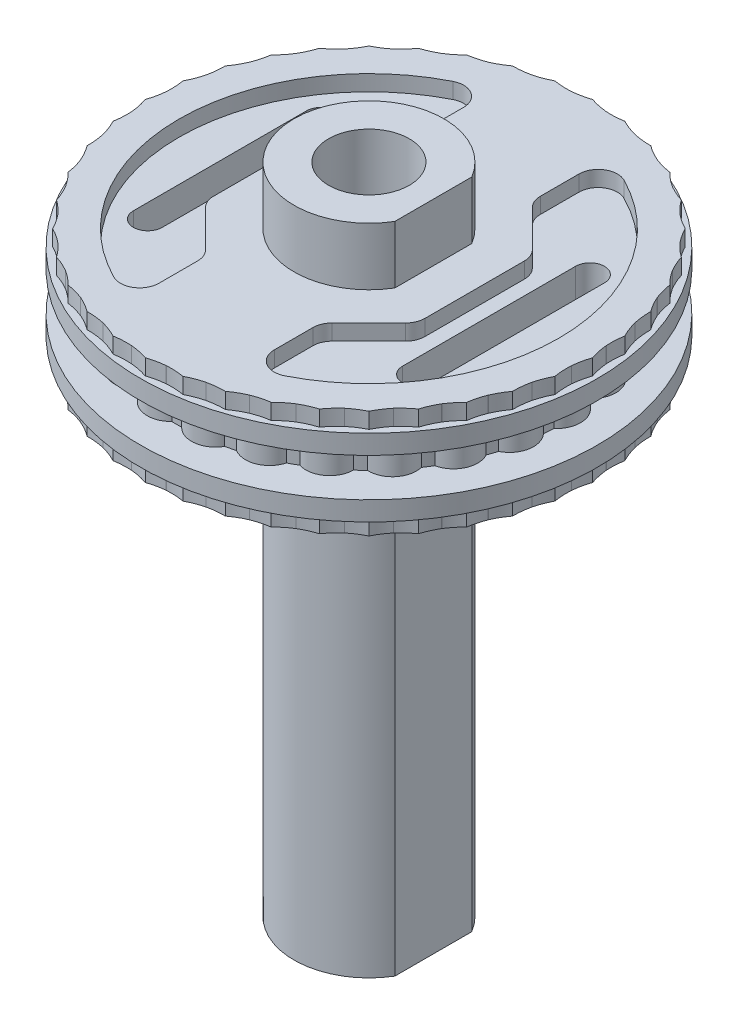
from build123d import *

# Parameters (mm, degrees)
SKETCH1_W                 = 5
SKETCH1_H                 = 1
BOSS_EXTRUDE1_START       = -1
BOSS_EXTRUDE1_DEPTH       = 1
CIRPATTERN1_COUNT         = 25
BOSS_EXTRUDE2_DEPTH       = 0.4
CIRPATTERN2_COUNT         = 40
MIRROR2_COPY_1_DEPTH      = 0.4
MIRROR2_COPY_2_DEPTH      = 0.4
MIRROR2_COPY_3_DEPTH      = 0.4
MIRROR2_COPY_4_DEPTH      = 0.4
MIRROR2_COPY_5_DEPTH      = 0.4
MIRROR2_COPY_6_DEPTH      = 0.4
MIRROR2_COPY_7_DEPTH      = 0.4
MIRROR2_COPY_8_DEPTH      = 0.4
MIRROR2_COPY_9_DEPTH      = 0.4
MIRROR2_COPY_10_DEPTH     = 0.4
MIRROR2_COPY_11_DEPTH     = 0.4
MIRROR2_COPY_12_DEPTH     = 0.4
MIRROR2_COPY_13_DEPTH     = 0.4
MIRROR2_COPY_14_DEPTH     = 0.4
MIRROR2_COPY_15_DEPTH     = 0.4
MIRROR2_COPY_16_DEPTH     = 0.4
MIRROR2_COPY_17_DEPTH     = 0.4
MIRROR2_COPY_18_DEPTH     = 0.4
MIRROR2_COPY_19_DEPTH     = 0.4
MIRROR2_COPY_20_DEPTH     = 0.4
MIRROR2_COPY_21_DEPTH     = 0.4
MIRROR2_COPY_22_DEPTH     = 0.4
MIRROR2_COPY_23_DEPTH     = 0.4
MIRROR2_COPY_24_DEPTH     = 0.4
MIRROR2_COPY_25_DEPTH     = 0.4
MIRROR2_COPY_26_DEPTH     = 0.4
MIRROR2_COPY_27_DEPTH     = 0.4
MIRROR2_COPY_28_DEPTH     = 0.4
MIRROR2_COPY_29_DEPTH     = 0.4
MIRROR2_COPY_30_DEPTH     = 0.4
MIRROR2_COPY_31_DEPTH     = 0.4
MIRROR2_COPY_32_DEPTH     = 0.4
MIRROR2_COPY_33_DEPTH     = 0.4
MIRROR2_COPY_34_DEPTH     = 0.4
MIRROR2_COPY_35_DEPTH     = 0.4
MIRROR2_COPY_36_DEPTH     = 0.4
MIRROR2_COPY_37_DEPTH     = 0.4
MIRROR2_COPY_38_DEPTH     = 0.4
MIRROR2_COPY_39_DEPTH     = 0.4
BOSS_EXTRUDE4_DEPTH       = 0.01
BOSS_EXTRUDE3_START       = 1.5
BOSS_EXTRUDE3_DEPTH       = 17
CUT_EXTRUDE2_DEPTH        = 17.403157966
CUT_EXTRUDE2_DEPTH_BACK   = 17.403157966
CUT_EXTRUDE3_DEPTH        = 0.41
F_2_0MM_DOWEL_HOLE1_D     = 2.1
F_2_0MM_DOWEL_HOLE1_DEPTH = 7.36909635
F_2_0MM_DOWEL_HOLE1_TIP   = 0.63090365
F_2_0MM_DOWEL_HOLE2_D     = 2.1
F_2_0MM_DOWEL_HOLE2_DEPTH = 7.36909635
F_2_0MM_DOWEL_HOLE2_TIP   = 0.63090365


with BuildPart() as part:
    # Sketch1 → Revolve1 (revolve)
    with BuildSketch(Plane(origin=(0, 0, 0), x_dir=(0, 0, -1), z_dir=(1, 0, 0)), mode=Mode.PRIVATE) as revolve1_sk:
        with Locations((-2.5, 0)):
            Rectangle(SKETCH1_W, SKETCH1_H)
    revolve(revolve1_sk.sketch.rotate(Axis((0, -0.599020678, 0), (0, 1, 0)), 180), axis=Axis((0, -0.599020678, 0), (0, 1, 0)))

    # Sketch2 → Boss-Extrude1 (add)
    with BuildSketch(Plane(origin=(0, 0.5, 0), x_dir=(1, 0, 0), z_dir=(0, 1, 0)).offset(BOSS_EXTRUDE1_START)):
        with BuildLine():
            ThreePointArc((-0.5, 4.974937186), (0, 5.224937186), (0.5, 4.974937186))
            ThreePointArc((0.5, 4.974937186), (0, 5), (-0.5, 4.974937186))
        make_face()
    boss_extrude1 = extrude(amount=BOSS_EXTRUDE1_DEPTH)

    # CirPattern1: Boss-Extrude1 ×25 about axis
    cirpattern1_axis = Axis((0, 0, 0), (0, 1, 0))
    for i in range(1, CIRPATTERN1_COUNT):
        add(boss_extrude1.rotate(cirpattern1_axis, i * 360 / CIRPATTERN1_COUNT))

    # Sketch3 → Revolve2 (revolve)
    with BuildSketch(Plane(origin=(0, 0, 0), x_dir=(0, 0, -1), z_dir=(1, 0, 0)), mode=Mode.PRIVATE) as revolve2_sk:
        Polygon((0, 0.5), (-5.938665307, 0.5), (-5.938665307, 1), (-5.738665307, 1), (-5.738665307, 1.4), (0, 1.4), align=None)
    revolve2 = revolve(revolve2_sk.sketch.rotate(Axis((0, 0, 0), (0, 1, 0)), 180), axis=Axis((0, 0, 0), (0, 1, 0)))

    # Sketch4 → Boss-Extrude2 (add)
    with BuildSketch(Plane(origin=(0, 1.4, 0), x_dir=(1, 0, 0), z_dir=(0, 1, 0))):
        with BuildLine():
            Line((0, 5.816841742), (0, 5.738665307))
            ThreePointArc((0, 5.738665307), (0.224059297, 5.734289576), (0.447776903, 5.721169054))
            ThreePointArc((0.447776903, 5.721169054), (0.221141488, 5.756148785), (0, 5.816841742))
        make_face()
        with BuildLine():
            ThreePointArc((-0.447776903, 5.721169054), (-0.224059297, 5.734289576), (0, 5.738665307))
            Line((0, 5.738665307), (0, 5.816841742))
            ThreePointArc((0, 5.816841742), (-0.221141488, 5.756148785), (-0.447776903, 5.721169054))
        make_face()
    boss_extrude2 = extrude(amount=-BOSS_EXTRUDE2_DEPTH)

    # CirPattern2: Boss-Extrude2 ×40 about axis
    cirpattern2_axis = Axis((0, 0, 0), (0, 1, 0))
    for i in range(1, CIRPATTERN2_COUNT):
        add(boss_extrude2.rotate(cirpattern2_axis, i * 360 / CIRPATTERN2_COUNT))

    # Mirror2: Revolve2, Boss-Extrude2 across plane
    add(revolve2.mirror(Plane.ZX))
    add(boss_extrude2.mirror(Plane.ZX))

    # Mirror2 copy 1 sketch → Mirror2 copy 1 (add)
    with BuildSketch(Plane(origin=(0, -1.4, 0), x_dir=(0.9876883405951378, 0, -0.15643446504023087), z_dir=(0, -1, 0))):
        with BuildLine():
            Line((0, -5.816841742), (0, -5.738665307))
            ThreePointArc((0, -5.738665307), (0.224059297, -5.734289576), (0.447776903, -5.721169054))
            ThreePointArc((0.447776903, -5.721169054), (0.221141488, -5.756148785), (0, -5.816841742))
        make_face()
        with BuildLine():
            ThreePointArc((-0.447776903, -5.721169054), (-0.224059297, -5.734289576), (0, -5.738665307))
            Line((0, -5.738665307), (0, -5.816841742))
            ThreePointArc((0, -5.816841742), (-0.221141488, -5.756148785), (-0.447776903, -5.721169054))
        make_face()
    extrude(amount=-MIRROR2_COPY_1_DEPTH)

    # Mirror2 copy 2 sketch → Mirror2 copy 2 (add)
    with BuildSketch(Plane(origin=(0, -1.4, 0), x_dir=(0.9510565162951535, 0, -0.3090169943749474), z_dir=(0, -1, 0))):
        with BuildLine():
            Line((0, -5.816841742), (0, -5.738665307))
            ThreePointArc((0, -5.738665307), (0.224059297, -5.734289576), (0.447776903, -5.721169054))
            ThreePointArc((0.447776903, -5.721169054), (0.221141488, -5.756148785), (0, -5.816841742))
        make_face()
        with BuildLine():
            ThreePointArc((-0.447776903, -5.721169054), (-0.224059297, -5.734289576), (0, -5.738665307))
            Line((0, -5.738665307), (0, -5.816841742))
            ThreePointArc((0, -5.816841742), (-0.221141488, -5.756148785), (-0.447776903, -5.721169054))
        make_face()
    extrude(amount=-MIRROR2_COPY_2_DEPTH)

    # Mirror2 copy 3 sketch → Mirror2 copy 3 (add)
    with BuildSketch(Plane(origin=(0, -1.4, 0), x_dir=(0.8910065241883679, 0, -0.45399049973954675), z_dir=(0, -1, 0))):
        with BuildLine():
            Line((0, -5.816841742), (0, -5.738665307))
            ThreePointArc((0, -5.738665307), (0.224059297, -5.734289576), (0.447776903, -5.721169054))
            ThreePointArc((0.447776903, -5.721169054), (0.221141488, -5.756148785), (0, -5.816841742))
        make_face()
        with BuildLine():
            ThreePointArc((-0.447776903, -5.721169054), (-0.224059297, -5.734289576), (0, -5.738665307))
            Line((0, -5.738665307), (0, -5.816841742))
            ThreePointArc((0, -5.816841742), (-0.221141488, -5.756148785), (-0.447776903, -5.721169054))
        make_face()
    extrude(amount=-MIRROR2_COPY_3_DEPTH)

    # Mirror2 copy 4 sketch → Mirror2 copy 4 (add)
    with BuildSketch(Plane(origin=(0, -1.4, 0), x_dir=(0.8090169943749475, 0, -0.5877852522924731), z_dir=(0, -1, 0))):
        with BuildLine():
            Line((0, -5.816841742), (0, -5.738665307))
            ThreePointArc((0, -5.738665307), (0.224059297, -5.734289576), (0.447776903, -5.721169054))
            ThreePointArc((0.447776903, -5.721169054), (0.221141488, -5.756148785), (0, -5.816841742))
        make_face()
        with BuildLine():
            ThreePointArc((-0.447776903, -5.721169054), (-0.224059297, -5.734289576), (0, -5.738665307))
            Line((0, -5.738665307), (0, -5.816841742))
            ThreePointArc((0, -5.816841742), (-0.221141488, -5.756148785), (-0.447776903, -5.721169054))
        make_face()
    extrude(amount=-MIRROR2_COPY_4_DEPTH)

    # Mirror2 copy 5 sketch → Mirror2 copy 5 (add)
    with BuildSketch(Plane(origin=(0, -1.4, 0), x_dir=(0.7071067811865476, 0, -0.7071067811865475), z_dir=(0, -1, 0))):
        with BuildLine():
            Line((0, -5.816841742), (0, -5.738665307))
            ThreePointArc((0, -5.738665307), (0.224059297, -5.734289576), (0.447776903, -5.721169054))
            ThreePointArc((0.447776903, -5.721169054), (0.221141488, -5.756148785), (0, -5.816841742))
        make_face()
        with BuildLine():
            ThreePointArc((-0.447776903, -5.721169054), (-0.224059297, -5.734289576), (0, -5.738665307))
            Line((0, -5.738665307), (0, -5.816841742))
            ThreePointArc((0, -5.816841742), (-0.221141488, -5.756148785), (-0.447776903, -5.721169054))
        make_face()
    extrude(amount=-MIRROR2_COPY_5_DEPTH)

    # Mirror2 copy 6 sketch → Mirror2 copy 6 (add)
    with BuildSketch(Plane(origin=(0, -1.4, 0), x_dir=(0.5877852522924731, 0, -0.8090169943749475), z_dir=(0, -1, 0))):
        with BuildLine():
            Line((0, -5.816841742), (0, -5.738665307))
            ThreePointArc((0, -5.738665307), (0.224059297, -5.734289576), (0.447776903, -5.721169054))
            ThreePointArc((0.447776903, -5.721169054), (0.221141488, -5.756148785), (0, -5.816841742))
        make_face()
        with BuildLine():
            ThreePointArc((-0.447776903, -5.721169054), (-0.224059297, -5.734289576), (0, -5.738665307))
            Line((0, -5.738665307), (0, -5.816841742))
            ThreePointArc((0, -5.816841742), (-0.221141488, -5.756148785), (-0.447776903, -5.721169054))
        make_face()
    extrude(amount=-MIRROR2_COPY_6_DEPTH)

    # Mirror2 copy 7 sketch → Mirror2 copy 7 (add)
    with BuildSketch(Plane(origin=(0, -1.4, 0), x_dir=(0.4539904997395468, 0, -0.8910065241883678), z_dir=(0, -1, 0))):
        with BuildLine():
            Line((0, -5.816841742), (0, -5.738665307))
            ThreePointArc((0, -5.738665307), (0.224059297, -5.734289576), (0.447776903, -5.721169054))
            ThreePointArc((0.447776903, -5.721169054), (0.221141488, -5.756148785), (0, -5.816841742))
        make_face()
        with BuildLine():
            ThreePointArc((-0.447776903, -5.721169054), (-0.224059297, -5.734289576), (0, -5.738665307))
            Line((0, -5.738665307), (0, -5.816841742))
            ThreePointArc((0, -5.816841742), (-0.221141488, -5.756148785), (-0.447776903, -5.721169054))
        make_face()
    extrude(amount=-MIRROR2_COPY_7_DEPTH)

    # Mirror2 copy 8 sketch → Mirror2 copy 8 (add)
    with BuildSketch(Plane(origin=(0, -1.4, 0), x_dir=(0.30901699437494745, 0, -0.9510565162951535), z_dir=(0, -1, 0))):
        with BuildLine():
            Line((0, -5.816841742), (0, -5.738665307))
            ThreePointArc((0, -5.738665307), (0.224059297, -5.734289576), (0.447776903, -5.721169054))
            ThreePointArc((0.447776903, -5.721169054), (0.221141488, -5.756148785), (0, -5.816841742))
        make_face()
        with BuildLine():
            ThreePointArc((-0.447776903, -5.721169054), (-0.224059297, -5.734289576), (0, -5.738665307))
            Line((0, -5.738665307), (0, -5.816841742))
            ThreePointArc((0, -5.816841742), (-0.221141488, -5.756148785), (-0.447776903, -5.721169054))
        make_face()
    extrude(amount=-MIRROR2_COPY_8_DEPTH)

    # Mirror2 copy 9 sketch → Mirror2 copy 9 (add)
    with BuildSketch(Plane(origin=(0, -1.4, 0), x_dir=(0.15643446504023092, 0, -0.9876883405951378), z_dir=(0, -1, 0))):
        with BuildLine():
            Line((0, -5.816841742), (0, -5.738665307))
            ThreePointArc((0, -5.738665307), (0.224059297, -5.734289576), (0.447776903, -5.721169054))
            ThreePointArc((0.447776903, -5.721169054), (0.221141488, -5.756148785), (0, -5.816841742))
        make_face()
        with BuildLine():
            ThreePointArc((-0.447776903, -5.721169054), (-0.224059297, -5.734289576), (0, -5.738665307))
            Line((0, -5.738665307), (0, -5.816841742))
            ThreePointArc((0, -5.816841742), (-0.221141488, -5.756148785), (-0.447776903, -5.721169054))
        make_face()
    extrude(amount=-MIRROR2_COPY_9_DEPTH)

    # Mirror2 copy 10 sketch → Mirror2 copy 10 (add)
    with BuildSketch(Plane(origin=(0, -1.4, 0), x_dir=(0, 0, -1), z_dir=(0, -1, 0))):
        with BuildLine():
            Line((0, -5.816841742), (0, -5.738665307))
            ThreePointArc((0, -5.738665307), (0.224059297, -5.734289576), (0.447776903, -5.721169054))
            ThreePointArc((0.447776903, -5.721169054), (0.221141488, -5.756148785), (0, -5.816841742))
        make_face()
        with BuildLine():
            ThreePointArc((-0.447776903, -5.721169054), (-0.224059297, -5.734289576), (0, -5.738665307))
            Line((0, -5.738665307), (0, -5.816841742))
            ThreePointArc((0, -5.816841742), (-0.221141488, -5.756148785), (-0.447776903, -5.721169054))
        make_face()
    extrude(amount=-MIRROR2_COPY_10_DEPTH)

    # Mirror2 copy 11 sketch → Mirror2 copy 11 (add)
    with BuildSketch(Plane(origin=(0, -1.4, 0), x_dir=(-0.1564344650402308, 0, -0.9876883405951378), z_dir=(0, -1, 0))):
        with BuildLine():
            Line((0, -5.816841742), (0, -5.738665307))
            ThreePointArc((0, -5.738665307), (0.224059297, -5.734289576), (0.447776903, -5.721169054))
            ThreePointArc((0.447776903, -5.721169054), (0.221141488, -5.756148785), (0, -5.816841742))
        make_face()
        with BuildLine():
            ThreePointArc((-0.447776903, -5.721169054), (-0.224059297, -5.734289576), (0, -5.738665307))
            Line((0, -5.738665307), (0, -5.816841742))
            ThreePointArc((0, -5.816841742), (-0.221141488, -5.756148785), (-0.447776903, -5.721169054))
        make_face()
    extrude(amount=-MIRROR2_COPY_11_DEPTH)

    # Mirror2 copy 12 sketch → Mirror2 copy 12 (add)
    with BuildSketch(Plane(origin=(0, -1.4, 0), x_dir=(-0.30901699437494734, 0, -0.9510565162951536), z_dir=(0, -1, 0))):
        with BuildLine():
            Line((0, -5.816841742), (0, -5.738665307))
            ThreePointArc((0, -5.738665307), (0.224059297, -5.734289576), (0.447776903, -5.721169054))
            ThreePointArc((0.447776903, -5.721169054), (0.221141488, -5.756148785), (0, -5.816841742))
        make_face()
        with BuildLine():
            ThreePointArc((-0.447776903, -5.721169054), (-0.224059297, -5.734289576), (0, -5.738665307))
            Line((0, -5.738665307), (0, -5.816841742))
            ThreePointArc((0, -5.816841742), (-0.221141488, -5.756148785), (-0.447776903, -5.721169054))
        make_face()
    extrude(amount=-MIRROR2_COPY_12_DEPTH)

    # Mirror2 copy 13 sketch → Mirror2 copy 13 (add)
    with BuildSketch(Plane(origin=(0, -1.4, 0), x_dir=(-0.4539904997395467, 0, -0.8910065241883679), z_dir=(0, -1, 0))):
        with BuildLine():
            Line((0, -5.816841742), (0, -5.738665307))
            ThreePointArc((0, -5.738665307), (0.224059297, -5.734289576), (0.447776903, -5.721169054))
            ThreePointArc((0.447776903, -5.721169054), (0.221141488, -5.756148785), (0, -5.816841742))
        make_face()
        with BuildLine():
            ThreePointArc((-0.447776903, -5.721169054), (-0.224059297, -5.734289576), (0, -5.738665307))
            Line((0, -5.738665307), (0, -5.816841742))
            ThreePointArc((0, -5.816841742), (-0.221141488, -5.756148785), (-0.447776903, -5.721169054))
        make_face()
    extrude(amount=-MIRROR2_COPY_13_DEPTH)

    # Mirror2 copy 14 sketch → Mirror2 copy 14 (add)
    with BuildSketch(Plane(origin=(0, -1.4, 0), x_dir=(-0.587785252292473, 0, -0.8090169943749475), z_dir=(0, -1, 0))):
        with BuildLine():
            Line((0, -5.816841742), (0, -5.738665307))
            ThreePointArc((0, -5.738665307), (0.224059297, -5.734289576), (0.447776903, -5.721169054))
            ThreePointArc((0.447776903, -5.721169054), (0.221141488, -5.756148785), (0, -5.816841742))
        make_face()
        with BuildLine():
            ThreePointArc((-0.447776903, -5.721169054), (-0.224059297, -5.734289576), (0, -5.738665307))
            Line((0, -5.738665307), (0, -5.816841742))
            ThreePointArc((0, -5.816841742), (-0.221141488, -5.756148785), (-0.447776903, -5.721169054))
        make_face()
    extrude(amount=-MIRROR2_COPY_14_DEPTH)

    # Mirror2 copy 15 sketch → Mirror2 copy 15 (add)
    with BuildSketch(Plane(origin=(0, -1.4, 0), x_dir=(-0.7071067811865475, 0, -0.7071067811865476), z_dir=(0, -1, 0))):
        with BuildLine():
            Line((0, -5.816841742), (0, -5.738665307))
            ThreePointArc((0, -5.738665307), (0.224059297, -5.734289576), (0.447776903, -5.721169054))
            ThreePointArc((0.447776903, -5.721169054), (0.221141488, -5.756148785), (0, -5.816841742))
        make_face()
        with BuildLine():
            ThreePointArc((-0.447776903, -5.721169054), (-0.224059297, -5.734289576), (0, -5.738665307))
            Line((0, -5.738665307), (0, -5.816841742))
            ThreePointArc((0, -5.816841742), (-0.221141488, -5.756148785), (-0.447776903, -5.721169054))
        make_face()
    extrude(amount=-MIRROR2_COPY_15_DEPTH)

    # Mirror2 copy 16 sketch → Mirror2 copy 16 (add)
    with BuildSketch(Plane(origin=(0, -1.4, 0), x_dir=(-0.8090169943749473, 0, -0.5877852522924732), z_dir=(0, -1, 0))):
        with BuildLine():
            Line((0, -5.816841742), (0, -5.738665307))
            ThreePointArc((0, -5.738665307), (0.224059297, -5.734289576), (0.447776903, -5.721169054))
            ThreePointArc((0.447776903, -5.721169054), (0.221141488, -5.756148785), (0, -5.816841742))
        make_face()
        with BuildLine():
            ThreePointArc((-0.447776903, -5.721169054), (-0.224059297, -5.734289576), (0, -5.738665307))
            Line((0, -5.738665307), (0, -5.816841742))
            ThreePointArc((0, -5.816841742), (-0.221141488, -5.756148785), (-0.447776903, -5.721169054))
        make_face()
    extrude(amount=-MIRROR2_COPY_16_DEPTH)

    # Mirror2 copy 17 sketch → Mirror2 copy 17 (add)
    with BuildSketch(Plane(origin=(0, -1.4, 0), x_dir=(-0.8910065241883678, 0, -0.45399049973954686), z_dir=(0, -1, 0))):
        with BuildLine():
            Line((0, -5.816841742), (0, -5.738665307))
            ThreePointArc((0, -5.738665307), (0.224059297, -5.734289576), (0.447776903, -5.721169054))
            ThreePointArc((0.447776903, -5.721169054), (0.221141488, -5.756148785), (0, -5.816841742))
        make_face()
        with BuildLine():
            ThreePointArc((-0.447776903, -5.721169054), (-0.224059297, -5.734289576), (0, -5.738665307))
            Line((0, -5.738665307), (0, -5.816841742))
            ThreePointArc((0, -5.816841742), (-0.221141488, -5.756148785), (-0.447776903, -5.721169054))
        make_face()
    extrude(amount=-MIRROR2_COPY_17_DEPTH)

    # Mirror2 copy 18 sketch → Mirror2 copy 18 (add)
    with BuildSketch(Plane(origin=(0, -1.4, 0), x_dir=(-0.9510565162951535, 0, -0.3090169943749475), z_dir=(0, -1, 0))):
        with BuildLine():
            Line((0, -5.816841742), (0, -5.738665307))
            ThreePointArc((0, -5.738665307), (0.224059297, -5.734289576), (0.447776903, -5.721169054))
            ThreePointArc((0.447776903, -5.721169054), (0.221141488, -5.756148785), (0, -5.816841742))
        make_face()
        with BuildLine():
            ThreePointArc((-0.447776903, -5.721169054), (-0.224059297, -5.734289576), (0, -5.738665307))
            Line((0, -5.738665307), (0, -5.816841742))
            ThreePointArc((0, -5.816841742), (-0.221141488, -5.756148785), (-0.447776903, -5.721169054))
        make_face()
    extrude(amount=-MIRROR2_COPY_18_DEPTH)

    # Mirror2 copy 19 sketch → Mirror2 copy 19 (add)
    with BuildSketch(Plane(origin=(0, -1.4, 0), x_dir=(-0.9876883405951377, 0, -0.15643446504023098), z_dir=(0, -1, 0))):
        with BuildLine():
            Line((0, -5.816841742), (0, -5.738665307))
            ThreePointArc((0, -5.738665307), (0.224059297, -5.734289576), (0.447776903, -5.721169054))
            ThreePointArc((0.447776903, -5.721169054), (0.221141488, -5.756148785), (0, -5.816841742))
        make_face()
        with BuildLine():
            ThreePointArc((-0.447776903, -5.721169054), (-0.224059297, -5.734289576), (0, -5.738665307))
            Line((0, -5.738665307), (0, -5.816841742))
            ThreePointArc((0, -5.816841742), (-0.221141488, -5.756148785), (-0.447776903, -5.721169054))
        make_face()
    extrude(amount=-MIRROR2_COPY_19_DEPTH)

    # Mirror2 copy 20 sketch → Mirror2 copy 20 (add)
    with BuildSketch(Plane(origin=(0, -1.4, 0), x_dir=(-1, 0, 0), z_dir=(0, -1, 0))):
        with BuildLine():
            Line((0, -5.816841742), (0, -5.738665307))
            ThreePointArc((0, -5.738665307), (0.224059297, -5.734289576), (0.447776903, -5.721169054))
            ThreePointArc((0.447776903, -5.721169054), (0.221141488, -5.756148785), (0, -5.816841742))
        make_face()
        with BuildLine():
            ThreePointArc((-0.447776903, -5.721169054), (-0.224059297, -5.734289576), (0, -5.738665307))
            Line((0, -5.738665307), (0, -5.816841742))
            ThreePointArc((0, -5.816841742), (-0.221141488, -5.756148785), (-0.447776903, -5.721169054))
        make_face()
    extrude(amount=-MIRROR2_COPY_20_DEPTH)

    # Mirror2 copy 21 sketch → Mirror2 copy 21 (add)
    with BuildSketch(Plane(origin=(0, -1.4, 0), x_dir=(-0.9876883405951378, 0, 0.15643446504023073), z_dir=(0, -1, 0))):
        with BuildLine():
            Line((0, -5.816841742), (0, -5.738665307))
            ThreePointArc((0, -5.738665307), (0.224059297, -5.734289576), (0.447776903, -5.721169054))
            ThreePointArc((0.447776903, -5.721169054), (0.221141488, -5.756148785), (0, -5.816841742))
        make_face()
        with BuildLine():
            ThreePointArc((-0.447776903, -5.721169054), (-0.224059297, -5.734289576), (0, -5.738665307))
            Line((0, -5.738665307), (0, -5.816841742))
            ThreePointArc((0, -5.816841742), (-0.221141488, -5.756148785), (-0.447776903, -5.721169054))
        make_face()
    extrude(amount=-MIRROR2_COPY_21_DEPTH)

    # Mirror2 copy 22 sketch → Mirror2 copy 22 (add)
    with BuildSketch(Plane(origin=(0, -1.4, 0), x_dir=(-0.9510565162951536, 0, 0.3090169943749473), z_dir=(0, -1, 0))):
        with BuildLine():
            Line((0, -5.816841742), (0, -5.738665307))
            ThreePointArc((0, -5.738665307), (0.224059297, -5.734289576), (0.447776903, -5.721169054))
            ThreePointArc((0.447776903, -5.721169054), (0.221141488, -5.756148785), (0, -5.816841742))
        make_face()
        with BuildLine():
            ThreePointArc((-0.447776903, -5.721169054), (-0.224059297, -5.734289576), (0, -5.738665307))
            Line((0, -5.738665307), (0, -5.816841742))
            ThreePointArc((0, -5.816841742), (-0.221141488, -5.756148785), (-0.447776903, -5.721169054))
        make_face()
    extrude(amount=-MIRROR2_COPY_22_DEPTH)

    # Mirror2 copy 23 sketch → Mirror2 copy 23 (add)
    with BuildSketch(Plane(origin=(0, -1.4, 0), x_dir=(-0.8910065241883679, 0, 0.4539904997395467), z_dir=(0, -1, 0))):
        with BuildLine():
            Line((0, -5.816841742), (0, -5.738665307))
            ThreePointArc((0, -5.738665307), (0.224059297, -5.734289576), (0.447776903, -5.721169054))
            ThreePointArc((0.447776903, -5.721169054), (0.221141488, -5.756148785), (0, -5.816841742))
        make_face()
        with BuildLine():
            ThreePointArc((-0.447776903, -5.721169054), (-0.224059297, -5.734289576), (0, -5.738665307))
            Line((0, -5.738665307), (0, -5.816841742))
            ThreePointArc((0, -5.816841742), (-0.221141488, -5.756148785), (-0.447776903, -5.721169054))
        make_face()
    extrude(amount=-MIRROR2_COPY_23_DEPTH)

    # Mirror2 copy 24 sketch → Mirror2 copy 24 (add)
    with BuildSketch(Plane(origin=(0, -1.4, 0), x_dir=(-0.8090169943749476, 0, 0.587785252292473), z_dir=(0, -1, 0))):
        with BuildLine():
            Line((0, -5.816841742), (0, -5.738665307))
            ThreePointArc((0, -5.738665307), (0.224059297, -5.734289576), (0.447776903, -5.721169054))
            ThreePointArc((0.447776903, -5.721169054), (0.221141488, -5.756148785), (0, -5.816841742))
        make_face()
        with BuildLine():
            ThreePointArc((-0.447776903, -5.721169054), (-0.224059297, -5.734289576), (0, -5.738665307))
            Line((0, -5.738665307), (0, -5.816841742))
            ThreePointArc((0, -5.816841742), (-0.221141488, -5.756148785), (-0.447776903, -5.721169054))
        make_face()
    extrude(amount=-MIRROR2_COPY_24_DEPTH)

    # Mirror2 copy 25 sketch → Mirror2 copy 25 (add)
    with BuildSketch(Plane(origin=(0, -1.4, 0), x_dir=(-0.7071067811865477, 0, 0.7071067811865475), z_dir=(0, -1, 0))):
        with BuildLine():
            Line((0, -5.816841742), (0, -5.738665307))
            ThreePointArc((0, -5.738665307), (0.224059297, -5.734289576), (0.447776903, -5.721169054))
            ThreePointArc((0.447776903, -5.721169054), (0.221141488, -5.756148785), (0, -5.816841742))
        make_face()
        with BuildLine():
            ThreePointArc((-0.447776903, -5.721169054), (-0.224059297, -5.734289576), (0, -5.738665307))
            Line((0, -5.738665307), (0, -5.816841742))
            ThreePointArc((0, -5.816841742), (-0.221141488, -5.756148785), (-0.447776903, -5.721169054))
        make_face()
    extrude(amount=-MIRROR2_COPY_25_DEPTH)

    # Mirror2 copy 26 sketch → Mirror2 copy 26 (add)
    with BuildSketch(Plane(origin=(0, -1.4, 0), x_dir=(-0.5877852522924732, 0, 0.8090169943749473), z_dir=(0, -1, 0))):
        with BuildLine():
            Line((0, -5.816841742), (0, -5.738665307))
            ThreePointArc((0, -5.738665307), (0.224059297, -5.734289576), (0.447776903, -5.721169054))
            ThreePointArc((0.447776903, -5.721169054), (0.221141488, -5.756148785), (0, -5.816841742))
        make_face()
        with BuildLine():
            ThreePointArc((-0.447776903, -5.721169054), (-0.224059297, -5.734289576), (0, -5.738665307))
            Line((0, -5.738665307), (0, -5.816841742))
            ThreePointArc((0, -5.816841742), (-0.221141488, -5.756148785), (-0.447776903, -5.721169054))
        make_face()
    extrude(amount=-MIRROR2_COPY_26_DEPTH)

    # Mirror2 copy 27 sketch → Mirror2 copy 27 (add)
    with BuildSketch(Plane(origin=(0, -1.4, 0), x_dir=(-0.4539904997395469, 0, 0.8910065241883678), z_dir=(0, -1, 0))):
        with BuildLine():
            Line((0, -5.816841742), (0, -5.738665307))
            ThreePointArc((0, -5.738665307), (0.224059297, -5.734289576), (0.447776903, -5.721169054))
            ThreePointArc((0.447776903, -5.721169054), (0.221141488, -5.756148785), (0, -5.816841742))
        make_face()
        with BuildLine():
            ThreePointArc((-0.447776903, -5.721169054), (-0.224059297, -5.734289576), (0, -5.738665307))
            Line((0, -5.738665307), (0, -5.816841742))
            ThreePointArc((0, -5.816841742), (-0.221141488, -5.756148785), (-0.447776903, -5.721169054))
        make_face()
    extrude(amount=-MIRROR2_COPY_27_DEPTH)

    # Mirror2 copy 28 sketch → Mirror2 copy 28 (add)
    with BuildSketch(Plane(origin=(0, -1.4, 0), x_dir=(-0.30901699437494756, 0, 0.9510565162951535), z_dir=(0, -1, 0))):
        with BuildLine():
            Line((0, -5.816841742), (0, -5.738665307))
            ThreePointArc((0, -5.738665307), (0.224059297, -5.734289576), (0.447776903, -5.721169054))
            ThreePointArc((0.447776903, -5.721169054), (0.221141488, -5.756148785), (0, -5.816841742))
        make_face()
        with BuildLine():
            ThreePointArc((-0.447776903, -5.721169054), (-0.224059297, -5.734289576), (0, -5.738665307))
            Line((0, -5.738665307), (0, -5.816841742))
            ThreePointArc((0, -5.816841742), (-0.221141488, -5.756148785), (-0.447776903, -5.721169054))
        make_face()
    extrude(amount=-MIRROR2_COPY_28_DEPTH)

    # Mirror2 copy 29 sketch → Mirror2 copy 29 (add)
    with BuildSketch(Plane(origin=(0, -1.4, 0), x_dir=(-0.15643446504023104, 0, 0.9876883405951377), z_dir=(0, -1, 0))):
        with BuildLine():
            Line((0, -5.816841742), (0, -5.738665307))
            ThreePointArc((0, -5.738665307), (0.224059297, -5.734289576), (0.447776903, -5.721169054))
            ThreePointArc((0.447776903, -5.721169054), (0.221141488, -5.756148785), (0, -5.816841742))
        make_face()
        with BuildLine():
            ThreePointArc((-0.447776903, -5.721169054), (-0.224059297, -5.734289576), (0, -5.738665307))
            Line((0, -5.738665307), (0, -5.816841742))
            ThreePointArc((0, -5.816841742), (-0.221141488, -5.756148785), (-0.447776903, -5.721169054))
        make_face()
    extrude(amount=-MIRROR2_COPY_29_DEPTH)

    # Mirror2 copy 30 sketch → Mirror2 copy 30 (add)
    with BuildSketch(Plane(origin=(0, -1.4, 0), x_dir=(0, 0, 1), z_dir=(0, -1, 0))):
        with BuildLine():
            Line((0, -5.816841742), (0, -5.738665307))
            ThreePointArc((0, -5.738665307), (0.224059297, -5.734289576), (0.447776903, -5.721169054))
            ThreePointArc((0.447776903, -5.721169054), (0.221141488, -5.756148785), (0, -5.816841742))
        make_face()
        with BuildLine():
            ThreePointArc((-0.447776903, -5.721169054), (-0.224059297, -5.734289576), (0, -5.738665307))
            Line((0, -5.738665307), (0, -5.816841742))
            ThreePointArc((0, -5.816841742), (-0.221141488, -5.756148785), (-0.447776903, -5.721169054))
        make_face()
    extrude(amount=-MIRROR2_COPY_30_DEPTH)

    # Mirror2 copy 31 sketch → Mirror2 copy 31 (add)
    with BuildSketch(Plane(origin=(0, -1.4, 0), x_dir=(0.15643446504023067, 0, 0.9876883405951378), z_dir=(0, -1, 0))):
        with BuildLine():
            Line((0, -5.816841742), (0, -5.738665307))
            ThreePointArc((0, -5.738665307), (0.224059297, -5.734289576), (0.447776903, -5.721169054))
            ThreePointArc((0.447776903, -5.721169054), (0.221141488, -5.756148785), (0, -5.816841742))
        make_face()
        with BuildLine():
            ThreePointArc((-0.447776903, -5.721169054), (-0.224059297, -5.734289576), (0, -5.738665307))
            Line((0, -5.738665307), (0, -5.816841742))
            ThreePointArc((0, -5.816841742), (-0.221141488, -5.756148785), (-0.447776903, -5.721169054))
        make_face()
    extrude(amount=-MIRROR2_COPY_31_DEPTH)

    # Mirror2 copy 32 sketch → Mirror2 copy 32 (add)
    with BuildSketch(Plane(origin=(0, -1.4, 0), x_dir=(0.30901699437494723, 0, 0.9510565162951536), z_dir=(0, -1, 0))):
        with BuildLine():
            Line((0, -5.816841742), (0, -5.738665307))
            ThreePointArc((0, -5.738665307), (0.224059297, -5.734289576), (0.447776903, -5.721169054))
            ThreePointArc((0.447776903, -5.721169054), (0.221141488, -5.756148785), (0, -5.816841742))
        make_face()
        with BuildLine():
            ThreePointArc((-0.447776903, -5.721169054), (-0.224059297, -5.734289576), (0, -5.738665307))
            Line((0, -5.738665307), (0, -5.816841742))
            ThreePointArc((0, -5.816841742), (-0.221141488, -5.756148785), (-0.447776903, -5.721169054))
        make_face()
    extrude(amount=-MIRROR2_COPY_32_DEPTH)

    # Mirror2 copy 33 sketch → Mirror2 copy 33 (add)
    with BuildSketch(Plane(origin=(0, -1.4, 0), x_dir=(0.45399049973954664, 0, 0.891006524188368), z_dir=(0, -1, 0))):
        with BuildLine():
            Line((0, -5.816841742), (0, -5.738665307))
            ThreePointArc((0, -5.738665307), (0.224059297, -5.734289576), (0.447776903, -5.721169054))
            ThreePointArc((0.447776903, -5.721169054), (0.221141488, -5.756148785), (0, -5.816841742))
        make_face()
        with BuildLine():
            ThreePointArc((-0.447776903, -5.721169054), (-0.224059297, -5.734289576), (0, -5.738665307))
            Line((0, -5.738665307), (0, -5.816841742))
            ThreePointArc((0, -5.816841742), (-0.221141488, -5.756148785), (-0.447776903, -5.721169054))
        make_face()
    extrude(amount=-MIRROR2_COPY_33_DEPTH)

    # Mirror2 copy 34 sketch → Mirror2 copy 34 (add)
    with BuildSketch(Plane(origin=(0, -1.4, 0), x_dir=(0.5877852522924729, 0, 0.8090169943749476), z_dir=(0, -1, 0))):
        with BuildLine():
            Line((0, -5.816841742), (0, -5.738665307))
            ThreePointArc((0, -5.738665307), (0.224059297, -5.734289576), (0.447776903, -5.721169054))
            ThreePointArc((0.447776903, -5.721169054), (0.221141488, -5.756148785), (0, -5.816841742))
        make_face()
        with BuildLine():
            ThreePointArc((-0.447776903, -5.721169054), (-0.224059297, -5.734289576), (0, -5.738665307))
            Line((0, -5.738665307), (0, -5.816841742))
            ThreePointArc((0, -5.816841742), (-0.221141488, -5.756148785), (-0.447776903, -5.721169054))
        make_face()
    extrude(amount=-MIRROR2_COPY_34_DEPTH)

    # Mirror2 copy 35 sketch → Mirror2 copy 35 (add)
    with BuildSketch(Plane(origin=(0, -1.4, 0), x_dir=(0.7071067811865474, 0, 0.7071067811865477), z_dir=(0, -1, 0))):
        with BuildLine():
            Line((0, -5.816841742), (0, -5.738665307))
            ThreePointArc((0, -5.738665307), (0.224059297, -5.734289576), (0.447776903, -5.721169054))
            ThreePointArc((0.447776903, -5.721169054), (0.221141488, -5.756148785), (0, -5.816841742))
        make_face()
        with BuildLine():
            ThreePointArc((-0.447776903, -5.721169054), (-0.224059297, -5.734289576), (0, -5.738665307))
            Line((0, -5.738665307), (0, -5.816841742))
            ThreePointArc((0, -5.816841742), (-0.221141488, -5.756148785), (-0.447776903, -5.721169054))
        make_face()
    extrude(amount=-MIRROR2_COPY_35_DEPTH)

    # Mirror2 copy 36 sketch → Mirror2 copy 36 (add)
    with BuildSketch(Plane(origin=(0, -1.4, 0), x_dir=(0.8090169943749473, 0, 0.5877852522924734), z_dir=(0, -1, 0))):
        with BuildLine():
            Line((0, -5.816841742), (0, -5.738665307))
            ThreePointArc((0, -5.738665307), (0.224059297, -5.734289576), (0.447776903, -5.721169054))
            ThreePointArc((0.447776903, -5.721169054), (0.221141488, -5.756148785), (0, -5.816841742))
        make_face()
        with BuildLine():
            ThreePointArc((-0.447776903, -5.721169054), (-0.224059297, -5.734289576), (0, -5.738665307))
            Line((0, -5.738665307), (0, -5.816841742))
            ThreePointArc((0, -5.816841742), (-0.221141488, -5.756148785), (-0.447776903, -5.721169054))
        make_face()
    extrude(amount=-MIRROR2_COPY_36_DEPTH)

    # Mirror2 copy 37 sketch → Mirror2 copy 37 (add)
    with BuildSketch(Plane(origin=(0, -1.4, 0), x_dir=(0.8910065241883678, 0, 0.45399049973954697), z_dir=(0, -1, 0))):
        with BuildLine():
            Line((0, -5.816841742), (0, -5.738665307))
            ThreePointArc((0, -5.738665307), (0.224059297, -5.734289576), (0.447776903, -5.721169054))
            ThreePointArc((0.447776903, -5.721169054), (0.221141488, -5.756148785), (0, -5.816841742))
        make_face()
        with BuildLine():
            ThreePointArc((-0.447776903, -5.721169054), (-0.224059297, -5.734289576), (0, -5.738665307))
            Line((0, -5.738665307), (0, -5.816841742))
            ThreePointArc((0, -5.816841742), (-0.221141488, -5.756148785), (-0.447776903, -5.721169054))
        make_face()
    extrude(amount=-MIRROR2_COPY_37_DEPTH)

    # Mirror2 copy 38 sketch → Mirror2 copy 38 (add)
    with BuildSketch(Plane(origin=(0, -1.4, 0), x_dir=(0.9510565162951535, 0, 0.3090169943749476), z_dir=(0, -1, 0))):
        with BuildLine():
            Line((0, -5.816841742), (0, -5.738665307))
            ThreePointArc((0, -5.738665307), (0.224059297, -5.734289576), (0.447776903, -5.721169054))
            ThreePointArc((0.447776903, -5.721169054), (0.221141488, -5.756148785), (0, -5.816841742))
        make_face()
        with BuildLine():
            ThreePointArc((-0.447776903, -5.721169054), (-0.224059297, -5.734289576), (0, -5.738665307))
            Line((0, -5.738665307), (0, -5.816841742))
            ThreePointArc((0, -5.816841742), (-0.221141488, -5.756148785), (-0.447776903, -5.721169054))
        make_face()
    extrude(amount=-MIRROR2_COPY_38_DEPTH)

    # Mirror2 copy 39 sketch → Mirror2 copy 39 (add)
    with BuildSketch(Plane(origin=(0, -1.4, 0), x_dir=(0.9876883405951377, 0, 0.15643446504023112), z_dir=(0, -1, 0))):
        with BuildLine():
            Line((0, -5.816841742), (0, -5.738665307))
            ThreePointArc((0, -5.738665307), (0.224059297, -5.734289576), (0.447776903, -5.721169054))
            ThreePointArc((0.447776903, -5.721169054), (0.221141488, -5.756148785), (0, -5.816841742))
        make_face()
        with BuildLine():
            ThreePointArc((-0.447776903, -5.721169054), (-0.224059297, -5.734289576), (0, -5.738665307))
            Line((0, -5.738665307), (0, -5.816841742))
            ThreePointArc((0, -5.816841742), (-0.221141488, -5.756148785), (-0.447776903, -5.721169054))
        make_face()
    extrude(amount=-MIRROR2_COPY_39_DEPTH)

    # Sketch16 → Boss-Extrude4 (add)
    with BuildSketch(Plane(origin=(0, 1.4, 0), x_dir=(1, 0, 0), z_dir=(0, 1, 0))):
        with BuildLine():
            Line((-1.337252047, 5.580684229), (-1.342077324, 5.579525783))
            ThreePointArc((-1.342077324, 5.579525783), (-1.568429743, 5.542759289), (-1.797502952, 5.532145243))
            ThreePointArc((-1.797502952, 5.532145243), (-1.98906585, 5.406086333), (-2.193799607, 5.302784437))
            Line((-2.193799607, 5.302784437), (-2.198384256, 5.300885413))
            ThreePointArc((-2.198384256, 5.300885413), (-2.416198355, 5.229162257), (-2.640790889, 5.182843942))
            ThreePointArc((-2.640790889, 5.182843942), (-2.810275372, 5.028369987), (-2.99632854, 4.894312494))
            Line((-2.99632854, 4.894312494), (-3.000559672, 4.891719653))
            ThreePointArc((-3.000559672, 4.891719653), (-3.204472144, 4.786805895), (-3.419053791, 4.705923823))
            ThreePointArc((-3.419053791, 4.705923823), (-3.562286588, 4.526838484), (-3.72507792, 4.365326333))
            Line((-3.72507792, 4.365326333), (-3.72885135, 4.362103519))
            ThreePointArc((-3.72885135, 4.362103519), (-3.913841194, 4.226582486), (-4.113128241, 4.113128241))
            ThreePointArc((-4.113128241, 4.113128241), (-4.226582486, 3.913841194), (-4.362103519, 3.72885135))
            Line((-4.362103519, 3.72885135), (-4.365326333, 3.72507792))
            ThreePointArc((-4.365326333, 3.72507792), (-4.526838484, 3.562286588), (-4.705923823, 3.419053791))
            ThreePointArc((-4.705923823, 3.419053791), (-4.786805895, 3.204472144), (-4.891719653, 3.000559672))
            Line((-4.891719653, 3.000559672), (-4.894312494, 2.99632854))
            ThreePointArc((-4.894312494, 2.99632854), (-5.028369987, 2.810275372), (-5.182843942, 2.640790889))
            ThreePointArc((-5.182843942, 2.640790889), (-5.229162257, 2.416198355), (-5.300885413, 2.198384256))
            Line((-5.300885413, 2.198384256), (-5.302784437, 2.193799607))
            ThreePointArc((-5.302784437, 2.193799607), (-5.406086333, 1.98906585), (-5.532145243, 1.797502952))
            ThreePointArc((-5.532145243, 1.797502952), (-5.542759289, 1.568429743), (-5.579525783, 1.342077324))
            Line((-5.579525783, 1.342077324), (-5.580684229, 1.337252047))
            ThreePointArc((-5.580684229, 1.337252047), (-5.650686892, 1.118878925), (-5.745226768, 0.909954526))
            ThreePointArc((-5.745226768, 0.909954526), (-5.719875192, 0.682041186), (-5.72077971, 0.452723994))
            Line((-5.72077971, 0.452723994), (-5.721169054, 0.447776903))
            ThreePointArc((-5.721169054, 0.447776903), (-5.756148785, 0.221141488), (-5.816841742, 0))
            ThreePointArc((-5.816841742, 0), (-5.756148785, -0.221141488), (-5.721169054, -0.447776903))
            Line((-5.721169054, -0.447776903), (-5.72077971, -0.452723994))
            ThreePointArc((-5.72077971, -0.452723994), (-5.719875192, -0.682041186), (-5.745226768, -0.909954526))
            ThreePointArc((-5.745226768, -0.909954526), (-5.650686892, -1.118878925), (-5.580684229, -1.337252047))
            Line((-5.580684229, -1.337252047), (-5.579525783, -1.342077324))
            ThreePointArc((-5.579525783, -1.342077324), (-5.542759289, -1.568429743), (-5.532145243, -1.797502952))
            ThreePointArc((-5.532145243, -1.797502952), (-5.406086333, -1.98906585), (-5.302784437, -2.193799607))
            Line((-5.302784437, -2.193799607), (-5.300885413, -2.198384256))
            ThreePointArc((-5.300885413, -2.198384256), (-5.229162257, -2.416198355), (-5.182843942, -2.640790889))
            ThreePointArc((-5.182843942, -2.640790889), (-5.028369987, -2.810275372), (-4.894312494, -2.99632854))
            Line((-4.894312494, -2.99632854), (-4.891719653, -3.000559672))
            ThreePointArc((-4.891719653, -3.000559672), (-4.786805895, -3.204472144), (-4.705923823, -3.419053791))
            ThreePointArc((-4.705923823, -3.419053791), (-4.526838484, -3.562286588), (-4.365326333, -3.72507792))
            Line((-4.365326333, -3.72507792), (-4.362103519, -3.72885135))
            ThreePointArc((-4.362103519, -3.72885135), (-4.226582486, -3.913841194), (-4.113128241, -4.113128241))
            ThreePointArc((-4.113128241, -4.113128241), (-3.913841194, -4.226582486), (-3.72885135, -4.362103519))
            Line((-3.72885135, -4.362103519), (-3.72507792, -4.365326333))
            ThreePointArc((-3.72507792, -4.365326333), (-3.562286588, -4.526838484), (-3.419053791, -4.705923823))
            ThreePointArc((-3.419053791, -4.705923823), (-3.204472144, -4.786805895), (-3.000559672, -4.891719653))
            Line((-3.000559672, -4.891719653), (-2.99632854, -4.894312494))
            ThreePointArc((-2.99632854, -4.894312494), (-2.810275372, -5.028369987), (-2.640790889, -5.182843942))
            ThreePointArc((-2.640790889, -5.182843942), (-2.416198355, -5.229162257), (-2.198384256, -5.300885413))
            Line((-2.198384256, -5.300885413), (-2.193799607, -5.302784437))
            ThreePointArc((-2.193799607, -5.302784437), (-1.98906585, -5.406086333), (-1.797502952, -5.532145243))
            ThreePointArc((-1.797502952, -5.532145243), (-1.568429743, -5.542759289), (-1.342077324, -5.579525783))
            Line((-1.342077324, -5.579525783), (-1.337252047, -5.580684229))
            ThreePointArc((-1.337252047, -5.580684229), (-1.118878925, -5.650686892), (-0.909954526, -5.745226768))
            ThreePointArc((-0.909954526, -5.745226768), (-0.682041186, -5.719875192), (-0.452723994, -5.72077971))
            Line((-0.452723994, -5.72077971), (-0.447776903, -5.721169054))
            ThreePointArc((-0.447776903, -5.721169054), (-0.221141488, -5.756148785), (0, -5.816841742))
            ThreePointArc((0, -5.816841742), (0.221141488, -5.756148785), (0.447776903, -5.721169054))
            Line((0.447776903, -5.721169054), (0.452723994, -5.72077971))
            ThreePointArc((0.452723994, -5.72077971), (0.682041186, -5.719875192), (0.909954526, -5.745226768))
            ThreePointArc((0.909954526, -5.745226768), (1.118878925, -5.650686892), (1.337252047, -5.580684229))
            Line((1.337252047, -5.580684229), (1.342077324, -5.579525783))
            ThreePointArc((1.342077324, -5.579525783), (1.568429743, -5.542759289), (1.797502952, -5.532145243))
            ThreePointArc((1.797502952, -5.532145243), (1.98906585, -5.406086333), (2.193799607, -5.302784437))
            Line((2.193799607, -5.302784437), (2.198384256, -5.300885413))
            ThreePointArc((2.198384256, -5.300885413), (2.416198355, -5.229162257), (2.640790889, -5.182843942))
            ThreePointArc((2.640790889, -5.182843942), (2.810275372, -5.028369987), (2.99632854, -4.894312494))
            Line((2.99632854, -4.894312494), (3.000559672, -4.891719653))
            ThreePointArc((3.000559672, -4.891719653), (3.204472144, -4.786805895), (3.419053791, -4.705923823))
            ThreePointArc((3.419053791, -4.705923823), (3.562286588, -4.526838484), (3.72507792, -4.365326333))
            Line((3.72507792, -4.365326333), (3.72885135, -4.362103519))
            ThreePointArc((3.72885135, -4.362103519), (3.913841194, -4.226582486), (4.113128241, -4.113128241))
            ThreePointArc((4.113128241, -4.113128241), (4.226582486, -3.913841194), (4.362103519, -3.72885135))
            Line((4.362103519, -3.72885135), (4.365326333, -3.72507792))
            ThreePointArc((4.365326333, -3.72507792), (4.526838484, -3.562286588), (4.705923823, -3.419053791))
            ThreePointArc((4.705923823, -3.419053791), (4.786805895, -3.204472144), (4.891719653, -3.000559672))
            Line((4.891719653, -3.000559672), (4.894312494, -2.99632854))
            ThreePointArc((4.894312494, -2.99632854), (5.028369987, -2.810275372), (5.182843942, -2.640790889))
            ThreePointArc((5.182843942, -2.640790889), (5.229162257, -2.416198355), (5.300885413, -2.198384256))
            Line((5.300885413, -2.198384256), (5.302784437, -2.193799607))
            ThreePointArc((5.302784437, -2.193799607), (5.406086333, -1.98906585), (5.532145243, -1.797502952))
            ThreePointArc((5.532145243, -1.797502952), (5.542759289, -1.568429743), (5.579525783, -1.342077324))
            Line((5.579525783, -1.342077324), (5.580684229, -1.337252047))
            ThreePointArc((5.580684229, -1.337252047), (5.650686892, -1.118878925), (5.745226768, -0.909954526))
            ThreePointArc((5.745226768, -0.909954526), (5.719875192, -0.682041186), (5.72077971, -0.452723994))
            Line((5.72077971, -0.452723994), (5.721169054, -0.447776903))
            ThreePointArc((5.721169054, -0.447776903), (5.756148785, -0.221141488), (5.816841742, 0))
            ThreePointArc((5.816841742, 0), (5.756148785, 0.221141488), (5.721169054, 0.447776903))
            Line((5.721169054, 0.447776903), (5.72077971, 0.452723994))
            ThreePointArc((5.72077971, 0.452723994), (5.719875192, 0.682041186), (5.745226768, 0.909954526))
            ThreePointArc((5.745226768, 0.909954526), (5.650686892, 1.118878925), (5.580684229, 1.337252047))
            Line((5.580684229, 1.337252047), (5.579525783, 1.342077324))
            ThreePointArc((5.579525783, 1.342077324), (5.542759289, 1.568429743), (5.532145243, 1.797502952))
            ThreePointArc((5.532145243, 1.797502952), (5.406086333, 1.98906585), (5.302784437, 2.193799607))
            Line((5.302784437, 2.193799607), (5.300885413, 2.198384256))
            ThreePointArc((5.300885413, 2.198384256), (5.229162257, 2.416198355), (5.182843942, 2.640790889))
            ThreePointArc((5.182843942, 2.640790889), (5.028369987, 2.810275372), (4.894312494, 2.99632854))
            Line((4.894312494, 2.99632854), (4.891719653, 3.000559672))
            ThreePointArc((4.891719653, 3.000559672), (4.786805895, 3.204472144), (4.705923823, 3.419053791))
            ThreePointArc((4.705923823, 3.419053791), (4.526838484, 3.562286588), (4.365326333, 3.72507792))
            Line((4.365326333, 3.72507792), (4.362103519, 3.72885135))
            ThreePointArc((4.362103519, 3.72885135), (4.226582486, 3.913841194), (4.113128241, 4.113128241))
            ThreePointArc((4.113128241, 4.113128241), (3.913841194, 4.226582486), (3.72885135, 4.362103519))
            Line((3.72885135, 4.362103519), (3.72507792, 4.365326333))
            ThreePointArc((3.72507792, 4.365326333), (3.562286588, 4.526838484), (3.419053791, 4.705923823))
            ThreePointArc((3.419053791, 4.705923823), (3.204472144, 4.786805895), (3.000559672, 4.891719653))
            Line((3.000559672, 4.891719653), (2.99632854, 4.894312494))
            ThreePointArc((2.99632854, 4.894312494), (2.810275372, 5.028369987), (2.640790889, 5.182843942))
            ThreePointArc((2.640790889, 5.182843942), (2.416198355, 5.229162257), (2.198384256, 5.300885413))
            Line((2.198384256, 5.300885413), (2.193799607, 5.302784437))
            ThreePointArc((2.193799607, 5.302784437), (1.98906585, 5.406086333), (1.797502952, 5.532145243))
            ThreePointArc((1.797502952, 5.532145243), (1.568429743, 5.542759289), (1.342077324, 5.579525783))
            Line((1.342077324, 5.579525783), (1.337252047, 5.580684229))
            ThreePointArc((1.337252047, 5.580684229), (1.118878925, 5.650686892), (0.909954526, 5.745226768))
            ThreePointArc((0.909954526, 5.745226768), (0.682041186, 5.719875192), (0.452723994, 5.72077971))
            Line((0.452723994, 5.72077971), (0.447776903, 5.721169054))
            ThreePointArc((0.447776903, 5.721169054), (0.221141488, 5.756148785), (0, 5.816841742))
            ThreePointArc((0, 5.816841742), (-0.221141488, 5.756148785), (-0.447776903, 5.721169054))
            Line((-0.447776903, 5.721169054), (-0.452723994, 5.72077971))
            ThreePointArc((-0.452723994, 5.72077971), (-0.682041186, 5.719875192), (-0.909954526, 5.745226768))
            ThreePointArc((-0.909954526, 5.745226768), (-1.118878925, 5.650686892), (-1.337252047, 5.580684229))
        make_face()
    extrude(amount=BOSS_EXTRUDE4_DEPTH)

    # Sketch5 → Boss-Extrude3 (add)
    with BuildSketch(Plane(origin=(0, 1.41, 0), x_dir=(1, 0, 0), z_dir=(0, 1, 0)).offset(BOSS_EXTRUDE3_START)):
        with BuildLine():
            Line((1.674066904, 1), (1.674066904, -1))
            ThreePointArc((1.674066904, -1), (-1.95, 0), (1.674066904, 1))
        make_face()
    extrude(amount=-BOSS_EXTRUDE3_DEPTH)

    # Sketch7 → Cut-Extrude2 (cut, two sides: drawn at the far end of the back side and taken through both)
    with BuildSketch(Plane.XZ.offset(-CUT_EXTRUDE2_DEPTH_BACK)):
        with BuildLine():
            Line((-3.875, -2.25), (-3.875, 2.25))
            ThreePointArc((-3.875, 2.25), (-3.5, 2.625), (-3.125, 2.25))
            Line((-3.125, 2.25), (-3.125, -2.25))
            ThreePointArc((-3.125, -2.25), (-3.5, -2.625), (-3.875, -2.25))
        make_face()
        with BuildLine():
            Line((3.875, -2.25), (3.875, 2.25))
            ThreePointArc((3.875, 2.25), (3.5, 2.625), (3.125, 2.25))
            Line((3.125, 2.25), (3.125, -2.25))
            ThreePointArc((3.125, -2.25), (3.5, -2.625), (3.875, -2.25))
        make_face()
    extrude(amount=CUT_EXTRUDE2_DEPTH + CUT_EXTRUDE2_DEPTH_BACK, mode=Mode.SUBTRACT)

    # Sketch9 → Cut-Extrude3 (cut)
    with BuildSketch(Plane(origin=(0, 1.41, 0), x_dir=(1, 0, 0), z_dir=(0, 1, 0))):
        with BuildLine():
            Line((-1.5, 3.962543338), (-1.5, 2.957106781))
            ThreePointArc((-1.5, 2.957106781), (-1.538060234, 2.765765065), (-1.646446609, 2.603553391))
            Line((-1.646446609, 2.603553391), (-2.603553391, 1.646446609))
            ThreePointArc((-2.603553391, 1.646446609), (-2.711939766, 1.484234935), (-2.75, 1.292893219))
            Line((-2.75, 1.292893219), (-2.75, -1.292893219))
            ThreePointArc((-2.75, -1.292893219), (-2.711939766, -1.484234935), (-2.603553391, -1.646446609))
            Line((-2.603553391, -1.646446609), (-1.646446609, -2.603553391))
            ThreePointArc((-1.646446609, -2.603553391), (-1.538060234, -2.765765065), (-1.5, -2.957106781))
            Line((-1.5, -2.957106781), (-1.5, -3.962543338))
            ThreePointArc((-1.5, -3.962543338), (-1.737937483, -4.388364002), (-2.22529295, -4.408909877))
            ThreePointArc((-2.22529295, -4.408909877), (-4.938665307, 0), (-2.22529295, 4.408909877))
            ThreePointArc((-2.22529295, 4.408909877), (-1.737937483, 4.388364002), (-1.5, 3.962543338))
        make_face()
    cut_extrude3 = extrude(amount=-CUT_EXTRUDE3_DEPTH, mode=Mode.SUBTRACT)

    # Mirror3: Cut-Extrude3 across plane
    add(cut_extrude3.mirror(Plane(origin=(0, 0, 0), x_dir=(0, 0, 1), z_dir=(1, 0, 0))), mode=Mode.SUBTRACT)

    # Ø2.0mm Dowel Hole1
    with Locations(Plane(origin=(0, 2.91, 0), x_dir=(1, 0, 0), z_dir=(0, 1, 0))):
        with Locations((0, 0)):
            Hole(F_2_0MM_DOWEL_HOLE1_D / 2, depth=F_2_0MM_DOWEL_HOLE1_DEPTH)
            with Locations((0, 0, -(F_2_0MM_DOWEL_HOLE1_DEPTH + F_2_0MM_DOWEL_HOLE1_TIP / 2))):  # 118° drill point
                Cone(0, F_2_0MM_DOWEL_HOLE1_D / 2, F_2_0MM_DOWEL_HOLE1_TIP, mode=Mode.SUBTRACT)

    # Ø2.0mm Dowel Hole2
    with Locations(Plane(origin=(0, -14.09, 0), x_dir=(-1, 0, 0), z_dir=(0, -1, 0))):
        with Locations((0, 0)):
            Hole(F_2_0MM_DOWEL_HOLE2_D / 2, depth=F_2_0MM_DOWEL_HOLE2_DEPTH)
            with Locations((0, 0, -(F_2_0MM_DOWEL_HOLE2_DEPTH + F_2_0MM_DOWEL_HOLE2_TIP / 2))):  # 118° drill point
                Cone(0, F_2_0MM_DOWEL_HOLE2_D / 2, F_2_0MM_DOWEL_HOLE2_TIP, mode=Mode.SUBTRACT)


solid = part.part
